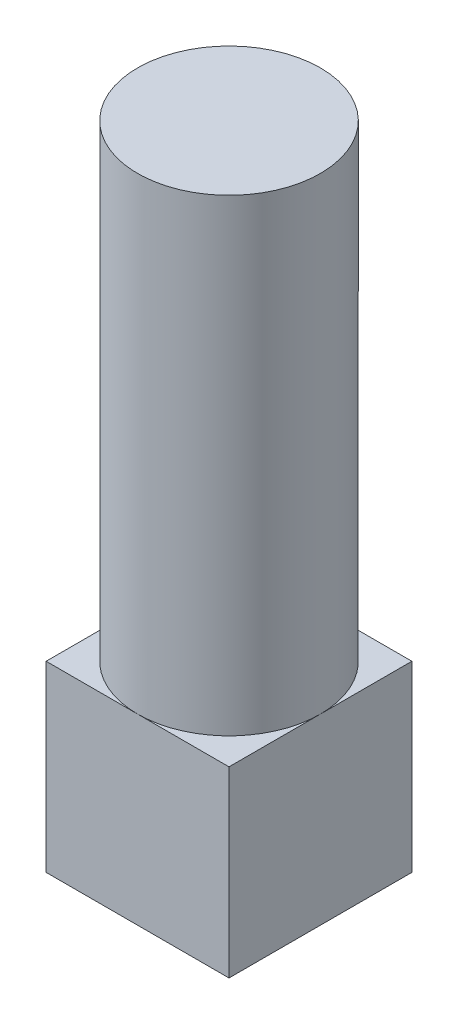
from build123d import *

# Parameters (mm, degrees)
SKETCH1_W           = 6.35
SKETCH1_H           = 6.35
BOSS_EXTRUDE1_DEPTH = 6.35
SKETCH2_R           = 3.175
BOSS_EXTRUDE2_DEPTH = 22.606


with BuildPart() as part:
    # Sketch1 → Boss-Extrude1 (new body)
    with BuildSketch(Plane(origin=(0, 0, 0), x_dir=(1, 0, 0), z_dir=(0, 1, 0))):
        Rectangle(SKETCH1_W, SKETCH1_H)
    extrude(amount=BOSS_EXTRUDE1_DEPTH)

    # Sketch2 → Boss-Extrude2 (add)
    with BuildSketch(Plane.XZ):
        Circle(SKETCH2_R)
    extrude(amount=-BOSS_EXTRUDE2_DEPTH)


solid = part.part
